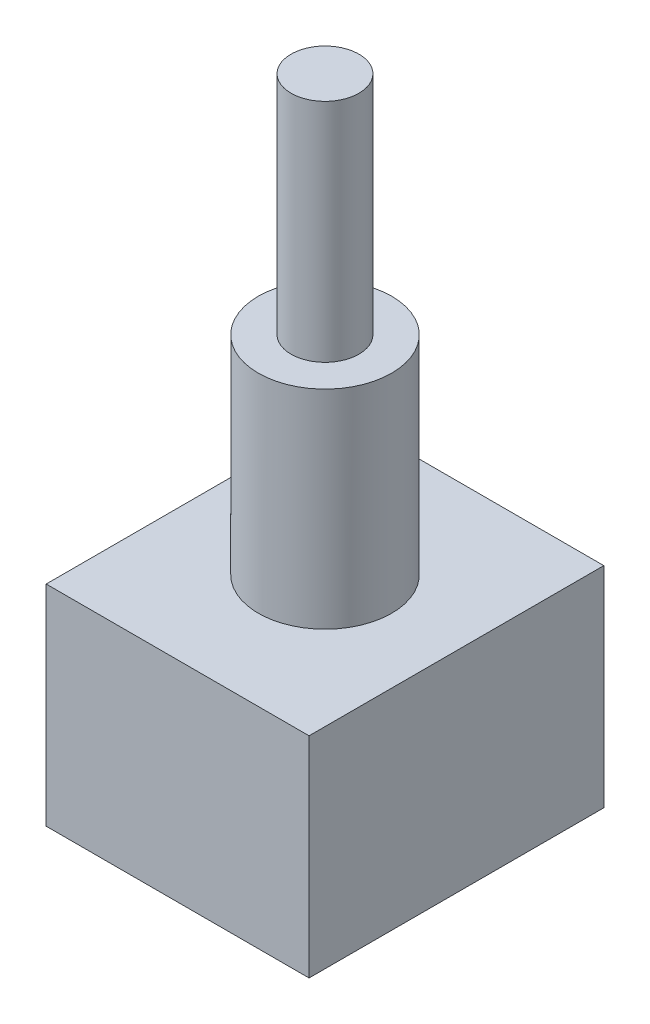
from build123d import *

# Parameters (mm, degrees)
SKETCH1_W           = 11.63
SKETCH1_H           = 13.04
BOSS_EXTRUDE1_DEPTH = 9.28
SKETCH3_R           = 2.95
BOSS_EXTRUDE3_DEPTH = 9.2
SKETCH4_R           = 1.5
BOSS_EXTRUDE4_DEPTH = 10


with BuildPart() as part:
    # Sketch1 → Boss-Extrude1 (new body)
    with BuildSketch(Plane(origin=(0, 0, 0), x_dir=(1, 0, 0), z_dir=(0, 1, 0))):
        Rectangle(SKETCH1_W, SKETCH1_H)
    extrude(amount=BOSS_EXTRUDE1_DEPTH)

    # Sketch3 → Boss-Extrude3 (add)
    with BuildSketch(Plane(origin=(0, 9.28, 0), x_dir=(1, 0, 0), z_dir=(0, 1, 0))):
        Circle(SKETCH3_R)
    extrude(amount=BOSS_EXTRUDE3_DEPTH)

    # Sketch4 → Boss-Extrude4 (add)
    with BuildSketch(Plane(origin=(0, 18.48, 0), x_dir=(1, 0, 0), z_dir=(0, 1, 0))):
        Circle(SKETCH4_R)
    extrude(amount=BOSS_EXTRUDE4_DEPTH)


solid = part.part
